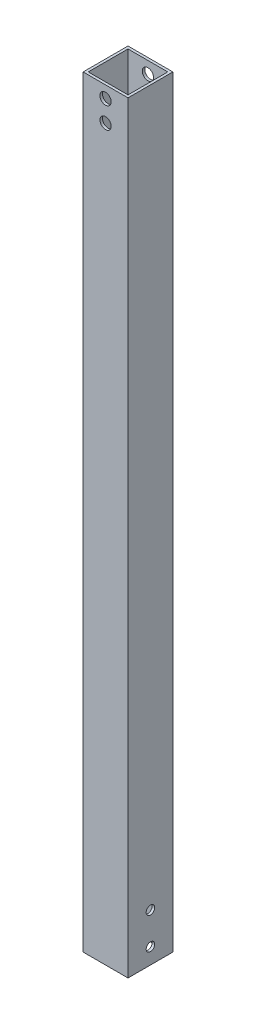
from build123d import *

# Parameters (mm, degrees)
SKETCH1_W               = 26.924
SKETCH1_H               = 26.924
SKETCH1_W_2             = 23.876
SKETCH1_H_2             = 23.876
EXTRUDE_THIN1_DEPTH     = 457.2
F_1_4_CLEARANCE_HOLE1_D = 6.7564
F_10_CLEARANCE_HOLE1_D  = 5.1054


with BuildPart() as part:
    # Sketch1 → Extrude-Thin1 (new body)
    with BuildSketch(Plane(origin=(0, 0, 0), x_dir=(1, 0, 0), z_dir=(0, 1, 0))):
        Rectangle(SKETCH1_W, SKETCH1_H)
        Rectangle(SKETCH1_W_2, SKETCH1_H_2, mode=Mode.SUBTRACT)
    extrude(amount=EXTRUDE_THIN1_DEPTH)

    # 1/4 Clearance Hole1 (through all)
    with Locations(Plane(origin=(0, 0, -13.462), x_dir=(-1, 0, 0), z_dir=(0, 0, -1))):
        with Locations((0, 450.0245), (0, 437.3245)):
            Hole(F_1_4_CLEARANCE_HOLE1_D / 2)

    # #10 Clearance Hole1 (through all)
    with Locations(Plane(origin=(13.462, 0, 0), x_dir=(0, 0, -1), z_dir=(1, 0, 0))):
        with Locations((0, 9.525), (0, 28.575)):
            Hole(F_10_CLEARANCE_HOLE1_D / 2)


solid = part.part
